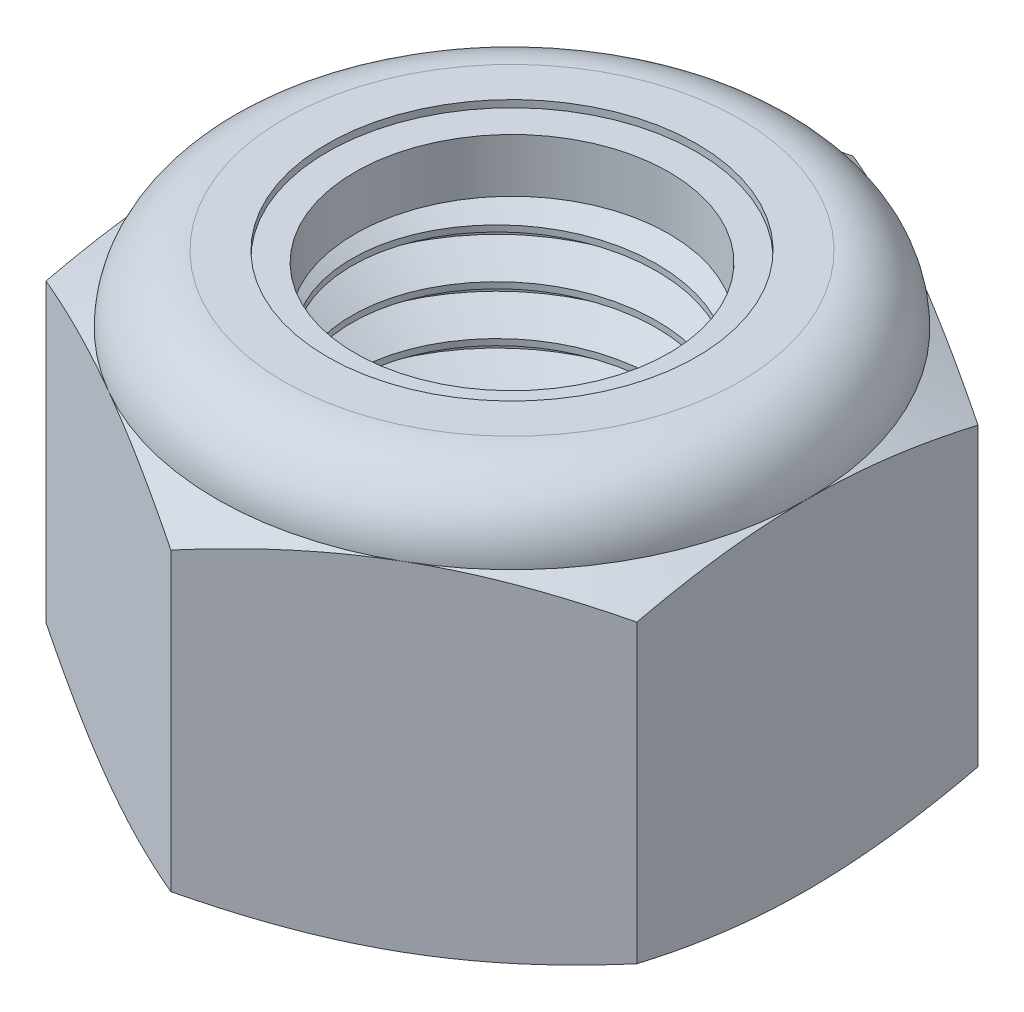
from build123d import *

# Parameters (mm, degrees)
SKETCH1_R        = 3.96875
EXTRUDE1_DEPTH   = 8.73125
SKETCH2_W        = 3.96875
SKETCH2_H        = 7.276041667
CUT_SWEEP1_PITCH = 1.058333333
SKETCH12_W       = 4.365625
SKETCH12_H       = 7.276041667


with BuildPart() as part:
    # Sketch1 → Extrude1 (new body)
    with BuildSketch(Plane(origin=(0, 0, 0), x_dir=(1, 0, 0), z_dir=(0, 1, 0))):
        Polygon((0, 7.332348419), (-6.35, 3.666174209), (-6.35, -3.666174209), (0, -7.332348419), (6.35, -3.666174209), (6.35, 3.666174209), align=None)
        with Locations(Location((0, 0, 0), (0, 0, 270))):
            Circle(SKETCH1_R, mode=Mode.SUBTRACT)
    extrude(amount=EXTRUDE1_DEPTH)

    # Sketch5 → Cut-Revolve3 (revolve, cut)
    with BuildSketch(Plane(origin=(0, 0, 0), x_dir=(0, 0, -1), z_dir=(1, 0, 0))):
        with BuildLine():
            Line((0, 0), (6.35, 0))
            Line((6.35, 0), (7.332348419, 0.458076591))
            Line((7.332348419, 0.458076591), (7.332348419, 6.817965076))
            Line((7.332348419, 6.817965076), (6.35, 7.276041667))
            ThreePointArc((6.35, 7.276041667), (5.923779347, 8.305029347), (4.894791667, 8.73125))
            Line((4.894791667, 8.73125), (4.894791667, 10.00125))
            Line((4.894791667, 10.00125), (8.602348419, 10.00125))
            Line((8.602348419, 10.00125), (8.602348419, -1.27))
            Line((8.602348419, -1.27), (0, -1.27))
            Line((0, -1.27), (0, 0))
        make_face()
    revolve(axis=Axis((0, 0, 0), (0, 1, 0)), mode=Mode.SUBTRACT)

    # Sketch6 → Cut-Revolve4 (revolve, cut)
    with BuildSketch(Plane(origin=(0, 0, 0), x_dir=(0, 0, -1), z_dir=(1, 0, 0)), mode=Mode.PRIVATE) as cut_revolve4_sk:
        with BuildLine():
            Line((0, 7.276041667), (6.1976, 7.276041667))
            ThreePointArc((6.1976, 7.276041667), (5.816016274, 8.197266274), (4.894791667, 8.57885))
            Line((4.894791667, 8.57885), (2.447395833, 8.57885))
            Line((2.447395833, 8.57885), (2.447395833, 10.00125))
            Line((2.447395833, 10.00125), (0, 10.00125))
            Line((0, 10.00125), (0, 7.276041667))
        make_face()
    revolve(cut_revolve4_sk.sketch.rotate(Axis((0, 10.00125, 0), (0, -1, 0)), 180), axis=Axis((0, 10.00125, 0), (0, -1, 0)), mode=Mode.SUBTRACT)

    # Sketch4 → Cut-Revolve2 (revolve, cut)
    with BuildSketch(Plane(origin=(0, 0, 0), x_dir=(0, 0, -1), z_dir=(1, 0, 0))):
        Polygon((0, 7.276041667), (4.365625, 7.276041667), (0, 5.240317297), align=None)
        Polygon((0, 2.03572437), (4.365625, 0), (0, 0), align=None)
    revolve(axis=Axis((0, 0, 0), (0, 1, 0)), mode=Mode.SUBTRACT)

    # Sketch12 → Revolve4 (revolve)
    with BuildSketch(Plane(origin=(0, 0, 0), x_dir=(0, 0, -1), z_dir=(1, 0, 0)), mode=Mode.PRIVATE) as revolve4_sk:
        with Locations((2.1828125, 3.638020834)):
            Rectangle(SKETCH12_W, SKETCH12_H)
    revolve(revolve4_sk.sketch.rotate(Axis((0, 0, 0), (0, 1, 0)), 36.764201122), axis=Axis((0, 0, 0), (0, 1, 0)))


with BuildPart() as body_2:
    # Sketch7 → Revolve2 (revolve)
    with BuildSketch(Plane(origin=(0, 0, 0), x_dir=(0, 0, -1), z_dir=(1, 0, 0))):
        with BuildLine():
            Line((3.3734375, 7.352241667), (6.119030844, 7.352241667))
            ThreePointArc((6.119030844, 7.352241667), (5.734762038, 8.169919611), (4.894791667, 8.50265))
            Line((4.894791667, 8.50265), (3.3734375, 8.50265))
            Line((3.3734375, 8.50265), (3.3734375, 7.352241667))
        make_face()
    revolve(axis=Axis((0, 7.352241667, 0), (0, 1, 0)))


with BuildPart() as body_3:
    # Sketch2 → Revolve1 (revolve)
    with BuildSketch(Plane(origin=(0, 0, 0), x_dir=(0, 0, -1), z_dir=(1, 0, 0))):
        with Locations((1.984375, 3.638020834)):
            Rectangle(SKETCH2_W, SKETCH2_H)
    revolve(axis=Axis((0, -3.96875, 0), (0, 1, 0)))

    # Cut-Sweep1: arcs per turn and ends read off the stored shape
    # Cut-Sweep1: the profile of Sketch9 screwed along a right-hand helix through 10.25 turns, 8 arcs to a turn; built about Z, then put on its axis
    cut_sweep1_z = Axis((0, 0, 0), (0, 0, 1))
    cut_sweep1_corners = [(4.083317944, 0, -0.9921875), (4.026033972, 0, -2.017447917), (3.281342336, 0, -1.5875), (3.281342336, 0, -1.455208333)]
    with BuildLine(mode=Mode.PRIVATE) as cut_sweep1_profile:
        Line(cut_sweep1_corners[0], cut_sweep1_corners[1])
        Line(cut_sweep1_corners[1], cut_sweep1_corners[2])
        Line(cut_sweep1_corners[2], cut_sweep1_corners[3])
        Line(cut_sweep1_corners[3], cut_sweep1_corners[0])
    cut_sweep1_cap = Face(cut_sweep1_profile.wire())
    cut_sweep1_turn_angles = [0, 22.5, 45, 67.5, 90, 112.5, 135, 157.5, 180, 202.5, 225, 247.5, 270, 292.5, 315, 337.5, 360]
    cut_sweep1_turn_weights = [1, 0.9238795325112867, 1, 0.9238795325112867, 1, 0.9238795325112867, 1, 0.9238795325112867, 1, 0.9238795325112867, 1, 0.9238795325112867, 1, 0.9238795325112867, 1, 0.9238795325112867, 1]
    cut_sweep1_turn_rails = [Edge.make_bspline([Vector(p[0], p[1], 0).rotate(cut_sweep1_z, cut_sweep1_turn_angles[k]) / cut_sweep1_turn_weights[k] + Vector(0, 0, p[2] + CUT_SWEEP1_PITCH * cut_sweep1_turn_angles[k] / 360) for k in range(17)], [0, 0, 0, 1, 1, 2, 2, 3, 3, 4, 4, 5, 5, 6, 6, 7, 7, 8, 8, 8], 2, cut_sweep1_turn_weights) for p in cut_sweep1_corners]
    cut_sweep1_turn_sides = [Face.make_surface_from_curves(cut_sweep1_turn_rails[p[0]], cut_sweep1_turn_rails[p[1]]) for p in [(0, 1), (1, 2), (2, 3), (3, 0)]]
    cut_sweep1_last_angles = [3600, 3622.5, 3645, 3667.5, 3690]
    cut_sweep1_last_weights = [1, 0.9238795325112867, 1, 0.9238795325112867, 1]
    cut_sweep1_last_rails = [Edge.make_bspline([Vector(p[0], p[1], 0).rotate(cut_sweep1_z, cut_sweep1_last_angles[k]) / cut_sweep1_last_weights[k] + Vector(0, 0, p[2] + CUT_SWEEP1_PITCH * cut_sweep1_last_angles[k] / 360) for k in range(5)], [0, 0, 0, 1, 1, 2, 2, 2], 2, cut_sweep1_last_weights) for p in cut_sweep1_corners]
    cut_sweep1_last_sides = [Face.make_surface_from_curves(cut_sweep1_last_rails[p[0]], cut_sweep1_last_rails[p[1]]) for p in [(0, 1), (1, 2), (2, 3), (3, 0)]]
    cut_sweep1 = Plane(origin=(0, 7.276041667, 0), x_dir=(0, 0, -1), z_dir=(0, -1, 0)) * Solid(Shell([*[p.moved(Location((0, 0, CUT_SWEEP1_PITCH * i))) for i in range(10) for p in cut_sweep1_turn_sides], *cut_sweep1_last_sides, cut_sweep1_cap, cut_sweep1_cap.rotate(cut_sweep1_z, 3690).moved(Location((0, 0, CUT_SWEEP1_PITCH * 3690 / 360)))]))
    add(cut_sweep1, mode=Mode.SUBTRACT)

    # Sketch11 → Revolve3 (revolve)
    with BuildSketch(Plane(origin=(0, 0, 0), x_dir=(0, 0, -1), z_dir=(1, 0, 0))):
        Polygon((0, 0), (4.365625, 0), (0, 2.03572437), align=None)
    revolve(axis=Axis((0, 8.73125, 0), (0, -1, 0)))


with BuildPart() as part_1:
    add(part.part)

    # Combine1: cut body 3
    add(body_3.part, mode=Mode.SUBTRACT)


solid = Compound([body_2.part, part_1.part])
